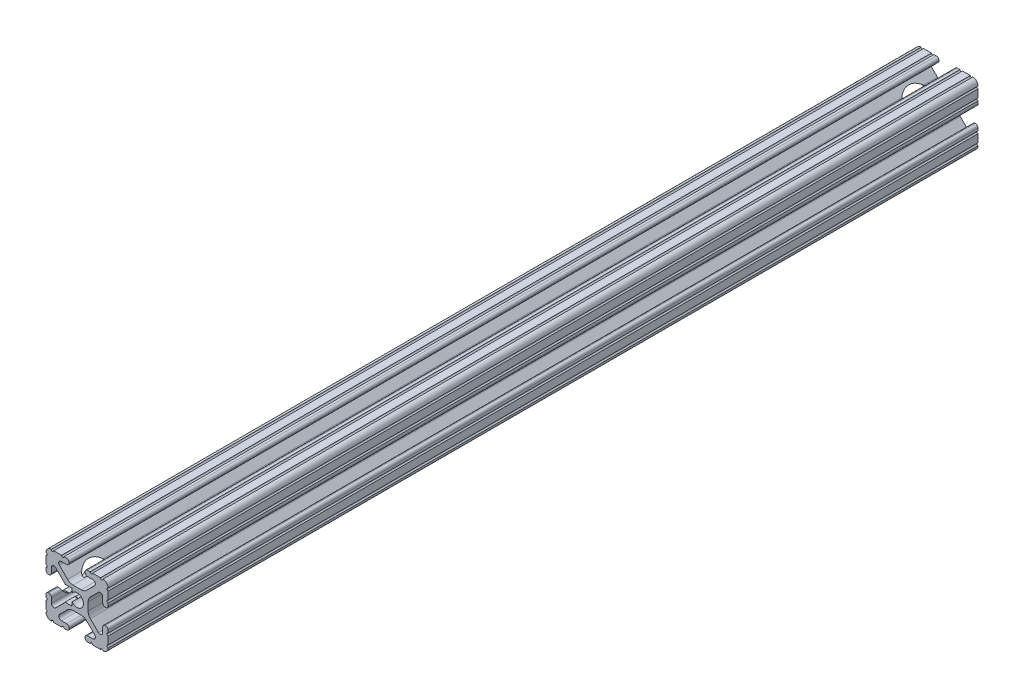
from build123d import *

# Parameters (mm, degrees)
SKETCH1_R           = 2.6035
BOSS_EXTRUDE1_DEPTH = 177.8
CUT_EXTRUDE1_DEPTH  = 10.668


with BuildPart() as part:
    # Sketch1 → Boss-Extrude1 (new, symmetric)
    with BuildSketch(Plane.XY):
        with BuildLine():
            Line((-7.179650497, -8.645192506), (-3.952270251, -5.423690499))
            ThreePointArc((-3.952270251, -5.423690499), (-2.922936451, -4.736929036), (-1.709253557, -4.4958))
            Line((-1.709253557, -4.4958), (1.709253557, -4.4958))
            ThreePointArc((1.709253557, -4.4958), (2.922936451, -4.736929036), (3.952270251, -5.423690499))
            Line((3.952270251, -5.423690499), (7.179650497, -8.645192506))
            ThreePointArc((7.179650497, -8.645192506), (7.41473083, -9.822813117), (6.416408329, -10.4902))
            Line((6.416408329, -10.4902), (4.287512407, -10.4902))
            ThreePointArc((4.287512407, -10.4902), (3.54574862, -10.79744862), (3.2385, -11.539212407))
            Line((3.2385, -11.539212407), (3.2385, -11.650987593))
            ThreePointArc((3.2385, -11.650987593), (3.54574862, -12.39275138), (4.287512407, -12.7))
            Line((4.287512407, -12.7), (5.317126718, -12.7))
            ThreePointArc((5.317126718, -12.7), (5.825126718, -12.192), (6.333126718, -12.7))
            Line((6.333126718, -12.7), (9.550443118, -12.7))
            ThreePointArc((9.550443118, -12.7), (10.058366869, -12.192000006), (10.566443095, -12.699847501))
            ThreePointArc((10.566443095, -12.699847501), (12.082537762, -12.08250727), (12.699846982, -10.566399977))
            ThreePointArc((12.699846982, -10.566399977), (12.192000006, -10.058323491), (12.7, -9.5504))
            Line((12.7, -9.5504), (12.7, -6.3330836))
            ThreePointArc((12.7, -6.3330836), (12.192, -5.8250836), (12.7, -5.3170836))
            Line((12.7, -5.3170836), (12.7, -4.287469289))
            ThreePointArc((12.7, -4.287469289), (12.39275138, -3.545705502), (11.650987593, -3.238456882))
            Line((11.650987593, -3.238456882), (11.539212407, -3.238456882))
            ThreePointArc((11.539212407, -3.238456882), (10.79744862, -3.545705502), (10.4902, -4.287469289))
            Line((10.4902, -4.287469289), (10.4902, -6.402089023))
            ThreePointArc((10.4902, -6.402089023), (9.856505071, -7.351067942), (8.737131347, -7.129408934))
            Line((8.737131347, -7.129408934), (5.441005833, -3.840816462))
            ThreePointArc((5.441005833, -3.840816462), (4.750877967, -2.809883091), (4.5085, -1.593185507))
            Line((4.5085, -1.593185507), (4.5085, 1.593185507))
            ThreePointArc((4.5085, 1.593185507), (4.750877967, 2.809883091), (5.441005833, 3.840816462))
            Line((5.441005833, 3.840816462), (8.737131347, 7.129408934))
            ThreePointArc((8.737131347, 7.129408934), (9.856505071, 7.351067942), (10.4902, 6.402089023))
            Line((10.4902, 6.402089023), (10.4902, 4.287469289))
            ThreePointArc((10.4902, 4.287469289), (10.79744862, 3.545705502), (11.539212407, 3.238456882))
            Line((11.539212407, 3.238456882), (11.650987593, 3.238456882))
            ThreePointArc((11.650987593, 3.238456882), (12.39275138, 3.545705502), (12.7, 4.287469289))
            Line((12.7, 4.287469289), (12.7, 5.3170836))
            ThreePointArc((12.7, 5.3170836), (12.192, 5.8250836), (12.7, 6.3330836))
            Line((12.7, 6.3330836), (12.7, 9.5504))
            ThreePointArc((12.7, 9.5504), (12.192000006, 10.058323491), (12.699846982, 10.566399977))
            ThreePointArc((12.699846982, 10.566399977), (12.082537762, 12.08250727), (10.566443095, 12.699847501))
            ThreePointArc((10.566443095, 12.699847501), (10.058366869, 12.192000006), (9.550443118, 12.7))
            Line((9.550443118, 12.7), (6.333126718, 12.7))
            ThreePointArc((6.333126718, 12.7), (5.825126718, 12.192), (5.317126718, 12.7))
            Line((5.317126718, 12.7), (4.287512407, 12.7))
            ThreePointArc((4.287512407, 12.7), (3.54574862, 12.39275138), (3.2385, 11.650987593))
            Line((3.2385, 11.650987593), (3.2385, 11.539212407))
            ThreePointArc((3.2385, 11.539212407), (3.54574862, 10.79744862), (4.287512407, 10.4902))
            Line((4.287512407, 10.4902), (6.476788598, 10.4902))
            ThreePointArc((6.476788598, 10.4902), (7.432222385, 9.85140422), (7.207036008, 8.724370562))
            Line((7.207036008, 8.724370562), (3.898272566, 5.423169045))
            ThreePointArc((3.898272566, 5.423169045), (2.869120213, 4.736787962), (1.655778399, 4.4958))
            Line((1.655778399, 4.4958), (-1.655778399, 4.4958))
            ThreePointArc((-1.655778399, 4.4958), (-2.869120213, 4.736787962), (-3.898272566, 5.423169045))
            Line((-3.898272566, 5.423169045), (-7.207036008, 8.724370562))
            ThreePointArc((-7.207036008, 8.724370562), (-7.432222385, 9.85140422), (-6.476788598, 10.4902))
            Line((-6.476788598, 10.4902), (-4.287512407, 10.4902))
            ThreePointArc((-4.287512407, 10.4902), (-3.54574862, 10.79744862), (-3.2385, 11.539212407))
            Line((-3.2385, 11.539212407), (-3.2385, 11.650987593))
            ThreePointArc((-3.2385, 11.650987593), (-3.54574862, 12.39275138), (-4.287512407, 12.7))
            Line((-4.287512407, 12.7), (-5.317126718, 12.7))
            ThreePointArc((-5.317126718, 12.7), (-5.825126718, 12.192), (-6.333126718, 12.7))
            Line((-6.333126718, 12.7), (-9.550443118, 12.7))
            ThreePointArc((-9.550443118, 12.7), (-10.058366869, 12.192000006), (-10.566443095, 12.699847501))
            ThreePointArc((-10.566443095, 12.699847501), (-12.082537762, 12.08250727), (-12.699846982, 10.566399977))
            ThreePointArc((-12.699846982, 10.566399977), (-12.192000006, 10.058323491), (-12.7, 9.5504))
            Line((-12.7, 9.5504), (-12.7, 6.3330836))
            ThreePointArc((-12.7, 6.3330836), (-12.192, 5.8250836), (-12.7, 5.3170836))
            Line((-12.7, 5.3170836), (-12.7, 4.287469289))
            ThreePointArc((-12.7, 4.287469289), (-12.39275138, 3.545705502), (-11.650987593, 3.238456882))
            Line((-11.650987593, 3.238456882), (-11.539212407, 3.238456882))
            ThreePointArc((-11.539212407, 3.238456882), (-10.79744862, 3.545705502), (-10.4902, 4.287469289))
            Line((-10.4902, 4.287469289), (-10.4902, 6.402089023))
            ThreePointArc((-10.4902, 6.402089023), (-9.856505071, 7.351067942), (-8.737131347, 7.129408934))
            Line((-8.737131347, 7.129408934), (-5.441005833, 3.840816462))
            ThreePointArc((-5.441005833, 3.840816462), (-4.750877967, 2.809883091), (-4.5085, 1.593185507))
            Line((-4.5085, 1.593185507), (-4.5085, -1.593185507))
            ThreePointArc((-4.5085, -1.593185507), (-4.750877967, -2.809883091), (-5.441005833, -3.840816462))
            Line((-5.441005833, -3.840816462), (-8.737131347, -7.129408934))
            ThreePointArc((-8.737131347, -7.129408934), (-9.856505071, -7.351067942), (-10.4902, -6.402089023))
            Line((-10.4902, -6.402089023), (-10.4902, -4.287469289))
            ThreePointArc((-10.4902, -4.287469289), (-10.79744862, -3.545705502), (-11.539212407, -3.238456882))
            Line((-11.539212407, -3.238456882), (-11.650987593, -3.238456882))
            ThreePointArc((-11.650987593, -3.238456882), (-12.39275138, -3.545705502), (-12.7, -4.287469289))
            Line((-12.7, -4.287469289), (-12.7, -5.3170836))
            ThreePointArc((-12.7, -5.3170836), (-12.192, -5.8250836), (-12.7, -6.3330836))
            Line((-12.7, -6.3330836), (-12.7, -9.5504))
            ThreePointArc((-12.7, -9.5504), (-12.192000006, -10.058323491), (-12.699846982, -10.566399977))
            ThreePointArc((-12.699846982, -10.566399977), (-12.082537762, -12.08250727), (-10.566443095, -12.699847501))
            ThreePointArc((-10.566443095, -12.699847501), (-10.058366869, -12.192000006), (-9.550443118, -12.7))
            Line((-9.550443118, -12.7), (-6.333126718, -12.7))
            ThreePointArc((-6.333126718, -12.7), (-5.825126718, -12.192), (-5.317126718, -12.7))
            Line((-5.317126718, -12.7), (-4.287512407, -12.7))
            ThreePointArc((-4.287512407, -12.7), (-3.54574862, -12.39275138), (-3.2385, -11.650987593))
            Line((-3.2385, -11.650987593), (-3.2385, -11.539212407))
            ThreePointArc((-3.2385, -11.539212407), (-3.54574862, -10.79744862), (-4.287512407, -10.4902))
            Line((-4.287512407, -10.4902), (-6.416408329, -10.4902))
            ThreePointArc((-6.416408329, -10.4902), (-7.41473083, -9.822813117), (-7.179650497, -8.645192506))
        make_face()
        Circle(SKETCH1_R, mode=Mode.SUBTRACT)
    extrude(amount=BOSS_EXTRUDE1_DEPTH, both=True)

    # Sketch2 → Cut-Extrude1 (cut)
    with BuildSketch(Plane.ZY.offset(12.7)):
        with BuildLine():
            Line((177.8, -3.175), (177.8, 3.175))
            Line((177.8, 3.175), (173.861703947, 3.175))
            ThreePointArc((173.861703947, 3.175), (162.611825542, 4.848472607), (164.693429601, -6.3330836))
            Line((164.693429601, -6.3330836), (170.586570399, -6.3330836))
            ThreePointArc((170.586570399, -6.3330836), (172.488472607, -5.028174458), (173.861703947, -3.175))
            Line((173.861703947, -3.175), (177.8, -3.175))
        make_face()
    cut_extrude1 = extrude(amount=-CUT_EXTRUDE1_DEPTH, mode=Mode.SUBTRACT)

    # Mirror1: Cut-Extrude1 across plane
    add(cut_extrude1.mirror(Plane.XY), mode=Mode.SUBTRACT)


solid = part.part
